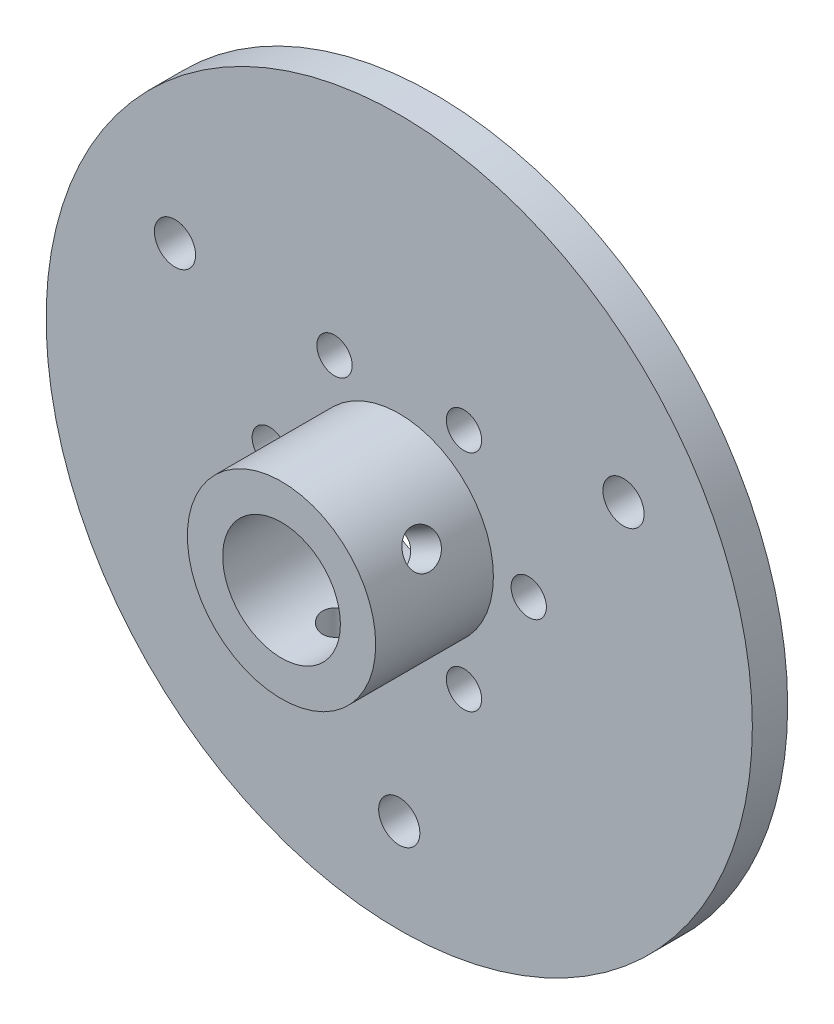
from build123d import *

# Parameters (mm, degrees)
SKETCH2_R           = 30
SKETCH2_R_2         = 5
SKETCH2_R_3         = 1.75
BOSS_EXTRUDE1_DEPTH = 3
SKETCH3_R           = 8
SKETCH3_R_2         = 5
BOSS_EXTRUDE2_DEPTH = 10
SKETCH4_R           = 1.5
CUT_EXTRUDE2_DEPTH  = 44.588989435
SKETCH12_R          = 1.5
CUT_EXTRUDE3_DEPTH  = 11.49377522
CIRPATTERN1_COUNT   = 3


with BuildPart() as part:
    # Sketch2 → Boss-Extrude1 (new body)
    with BuildSketch(Plane.XY):
        Circle(SKETCH2_R)
        Circle(SKETCH2_R_2, mode=Mode.SUBTRACT)
        with Locations((0, -22)):
            Circle(SKETCH2_R_3, mode=Mode.SUBTRACT)
        with Locations((-19.052558883, 11)):
            Circle(SKETCH2_R_3, mode=Mode.SUBTRACT)
        with Locations((19.052558883, 11)):
            Circle(SKETCH2_R_3, mode=Mode.SUBTRACT)
    extrude(amount=BOSS_EXTRUDE1_DEPTH)

    # Sketch3 → Boss-Extrude2 (add)
    with BuildSketch(Plane.XY.offset(3)):
        Circle(SKETCH3_R)
        Circle(SKETCH3_R_2, mode=Mode.SUBTRACT)
    extrude(amount=BOSS_EXTRUDE2_DEPTH)

    # Sketch4 → Cut-Extrude2 (cut, through all)
    with BuildSketch(Plane.XY.offset(3)):
        with Locations((-5.5, 9.526279442)):
            Circle(SKETCH4_R)
        with Locations((11, 0)):
            Circle(SKETCH4_R)
        with Locations((-5.5, -9.526279442)):
            Circle(SKETCH4_R)
        with Locations((5.5, 9.526279442)):
            Circle(SKETCH4_R)
        with Locations((5.5, -9.526279442)):
            Circle(SKETCH4_R)
        with Locations((-11, 0)):
            Circle(SKETCH4_R)
    extrude(amount=-CUT_EXTRUDE2_DEPTH, mode=Mode.SUBTRACT)

    # Sketch12 → Cut-Extrude3 (cut)
    with BuildSketch(Plane(origin=(0, 0, 0), x_dir=(1, 0, 0), z_dir=(0, 1, 0))):
        with Locations((0, -8)):
            Circle(SKETCH12_R)
    cut_extrude3 = extrude(amount=-CUT_EXTRUDE3_DEPTH, mode=Mode.SUBTRACT)

    # CirPattern1: Cut-Extrude3 ×3 about axis
    cirpattern1_axis = Axis((0, 0, 13), (0, 0, 1))
    for i in range(1, CIRPATTERN1_COUNT):
        add(cut_extrude3.rotate(cirpattern1_axis, i * 360 / CIRPATTERN1_COUNT), mode=Mode.SUBTRACT)


solid = part.part
